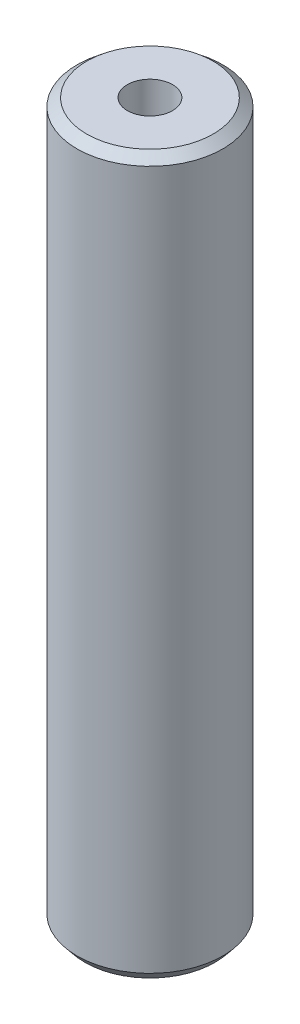
from build123d import *
from OCP.BRepFilletAPI import BRepFilletAPI_MakeChamfer

# Parameters (mm, degrees)
SKETCH1_R           = 40
BOSS_EXTRUDE1_DEPTH = 393.151625044
SKETCH2_R           = 12.396187357
CUT_EXTRUDE1_DEPTH  = 398.200453517
CHAMFER1_SIZE       = 4.373596908
CHAMFER1_SIZE2      = 5.311217663


with BuildPart() as part:
    # Sketch1 → Boss-Extrude1 (new body)
    with BuildSketch(Plane(origin=(0, 0, 0), x_dir=(1, 0, 0), z_dir=(0, 1, 0))):
        Circle(SKETCH1_R)
    extrude(amount=BOSS_EXTRUDE1_DEPTH)

    # Sketch2 → Cut-Extrude1 (cut, through all)
    with BuildSketch(Plane(origin=(0, 0, 0), x_dir=(1, 0, 0), z_dir=(0, 1, 0))):
        Circle(SKETCH2_R)
    extrude(amount=CUT_EXTRUDE1_DEPTH, mode=Mode.SUBTRACT)

    # Chamfer1: one chamfer whose edges measure the first distance from different faces: ONE call of the kernel's chamfer builder (chamfer() names one face for all edges)
    chamfer1_edges_1 = [part.edges().sort_by_distance(p)[0] for p in [
        (-40, 393.151625044, 0),
    ]]
    chamfer1_side_1 = [part.faces().sort_by_distance(p)[0] for p in [
        (-40, 196.575812522, 0),
    ]]
    chamfer1_edges_2 = [part.edges().sort_by_distance(p)[0] for p in [
        (-40, 0, 0),
    ]]
    chamfer1_side_2 = [part.faces().sort_by_distance(p)[0] for p in [
        (-38.86862915, 0, 0),
    ]]
    chamfer1 = BRepFilletAPI_MakeChamfer(part.part.solid().wrapped)
    for e in chamfer1_edges_1:
        chamfer1.Add(CHAMFER1_SIZE, CHAMFER1_SIZE2, e.wrapped, chamfer1_side_1[0].wrapped)  # the first distance lies on this face
    for e in chamfer1_edges_2:
        chamfer1.Add(CHAMFER1_SIZE, CHAMFER1_SIZE2, e.wrapped, chamfer1_side_2[0].wrapped)  # the first distance lies on this face
    add(Compound.cast(chamfer1.Shape()), mode=Mode.REPLACE)


solid = part.part
